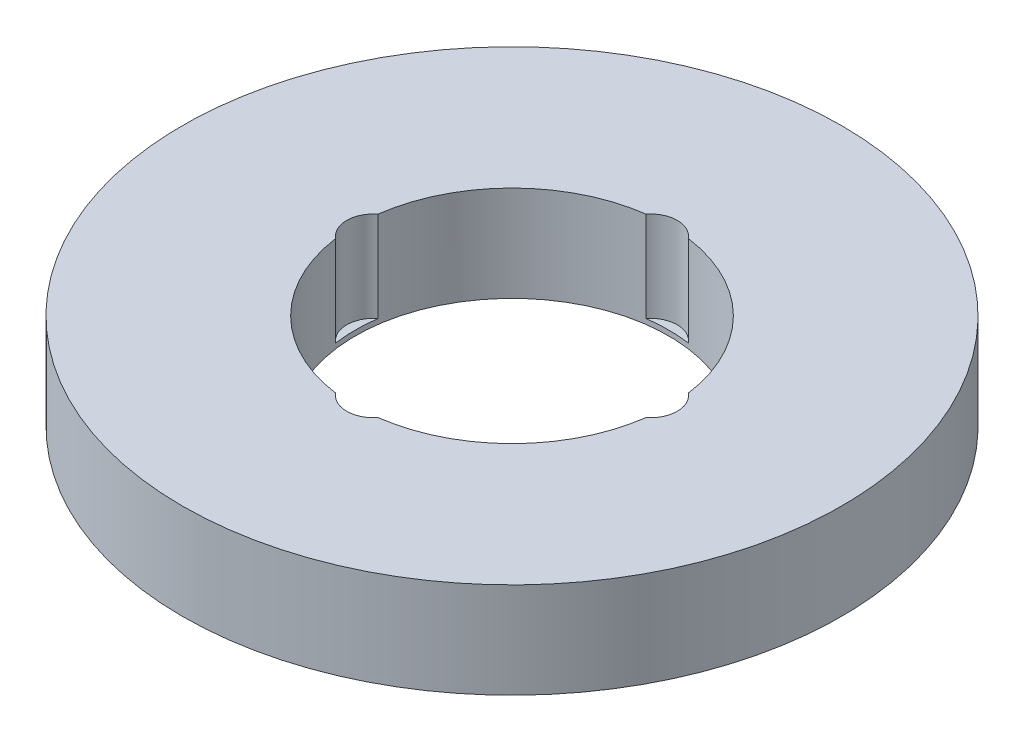
from build123d import *

# Parameters (mm, degrees)
SKETCH1_R           = 100
BOSS_EXTRUDE1_DEPTH = 29
SKETCH2_R           = 47.5
CUT_EXTRUDE1_DEPTH  = 145.364122967
SKETCH3_R           = 8.20106995
CUT_EXTRUDE2_DEPTH  = 27.435703435
CIRPATTERN1_COUNT   = 4


with BuildPart() as part:
    # Sketch1 → Boss-Extrude1 (new body)
    with BuildSketch(Plane(origin=(0, 0, 0), x_dir=(1, 0, 0), z_dir=(0, 1, 0))):
        Circle(SKETCH1_R)
    extrude(amount=BOSS_EXTRUDE1_DEPTH)

    # Sketch2 → Cut-Extrude1 (cut, through all)
    with BuildSketch(Plane(origin=(0, 0, 0), x_dir=(1, 0, 0), z_dir=(0, 1, 0))):
        Circle(SKETCH2_R)
    extrude(amount=CUT_EXTRUDE1_DEPTH, mode=Mode.SUBTRACT)

    # Sketch3 → Cut-Extrude2 (cut)
    with BuildSketch(Plane(origin=(0, 29, 0), x_dir=(1, 0, 0), z_dir=(0, 1, 0))):
        with Locations((-41.957869443, 0)):
            Circle(SKETCH3_R)
    cut_extrude2 = extrude(amount=-CUT_EXTRUDE2_DEPTH, mode=Mode.SUBTRACT)

    # CirPattern1: Cut-Extrude2 ×4 about axis
    cirpattern1_axis = Axis((0, 0, 0), (0, 1, 0))
    for i in range(1, CIRPATTERN1_COUNT):
        add(cut_extrude2.rotate(cirpattern1_axis, i * 360 / CIRPATTERN1_COUNT), mode=Mode.SUBTRACT)


solid = part.part
